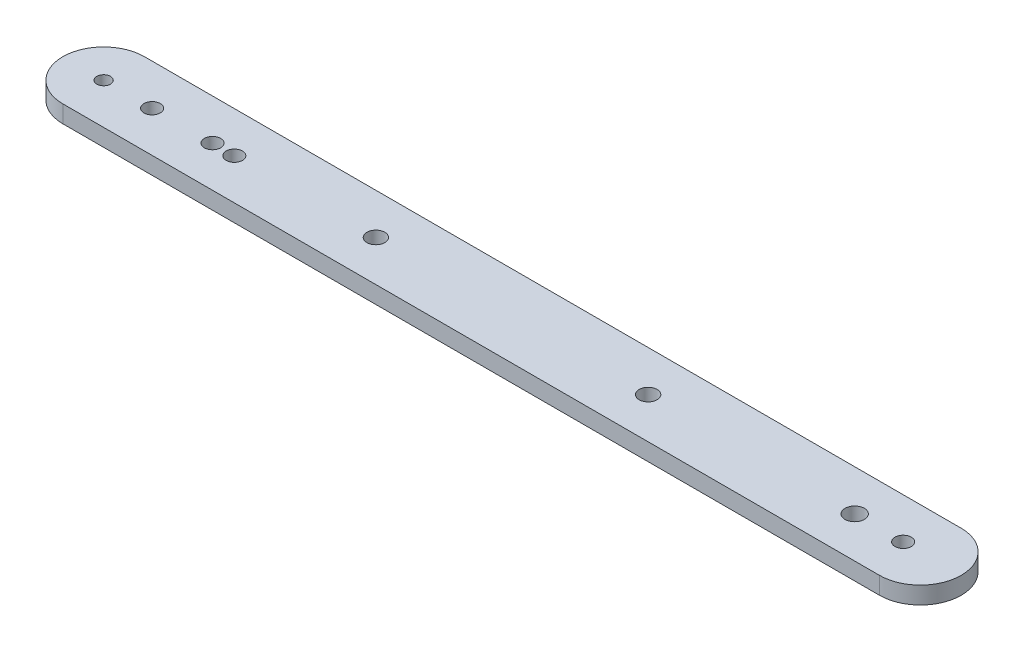
from build123d import *

# Parameters (mm, degrees)
SKETCH1_R           = 1.25
SKETCH1_R_2         = 1.5
SKETCH1_R_3         = 1.775813941
SKETCH1_R_4         = 1.65
BOSS_EXTRUDE1_DEPTH = 3.175


with BuildPart() as part:
    # Sketch1 → Boss-Extrude1 (new body)
    with BuildSketch(Plane(origin=(0, 0, 0), x_dir=(1, 0, 0), z_dir=(0, 1, 0))):
        with BuildLine():
            Line((-75, 7.5), (75, 7.5))
            ThreePointArc((75, 7.5), (82.5, 0), (75, -7.5))
            Line((75, -7.5), (-75, -7.5))
            ThreePointArc((-75, -7.5), (-82.5, 0), (-75, 7.5))
        make_face()
        with Locations((-75, 0)):
            Circle(SKETCH1_R, mode=Mode.SUBTRACT)
        with Locations((-66.1, 0)):
            Circle(SKETCH1_R_2, mode=Mode.SUBTRACT)
        with Locations((-55, 0)):
            Circle(SKETCH1_R_2, mode=Mode.SUBTRACT)
        with Locations((-51, 0)):
            Circle(SKETCH1_R_2, mode=Mode.SUBTRACT)
        with Locations((71.838939652, 0)):
            Circle(SKETCH1_R_2, mode=Mode.SUBTRACT)
        with Locations((62.938939652, 0)):
            Circle(SKETCH1_R_3, mode=Mode.SUBTRACT)
        with Locations((25, 0)):
            Circle(SKETCH1_R_4, mode=Mode.SUBTRACT)
        with Locations((-25, 0)):
            Circle(SKETCH1_R_4, mode=Mode.SUBTRACT)
    extrude(amount=BOSS_EXTRUDE1_DEPTH)


solid = part.part
